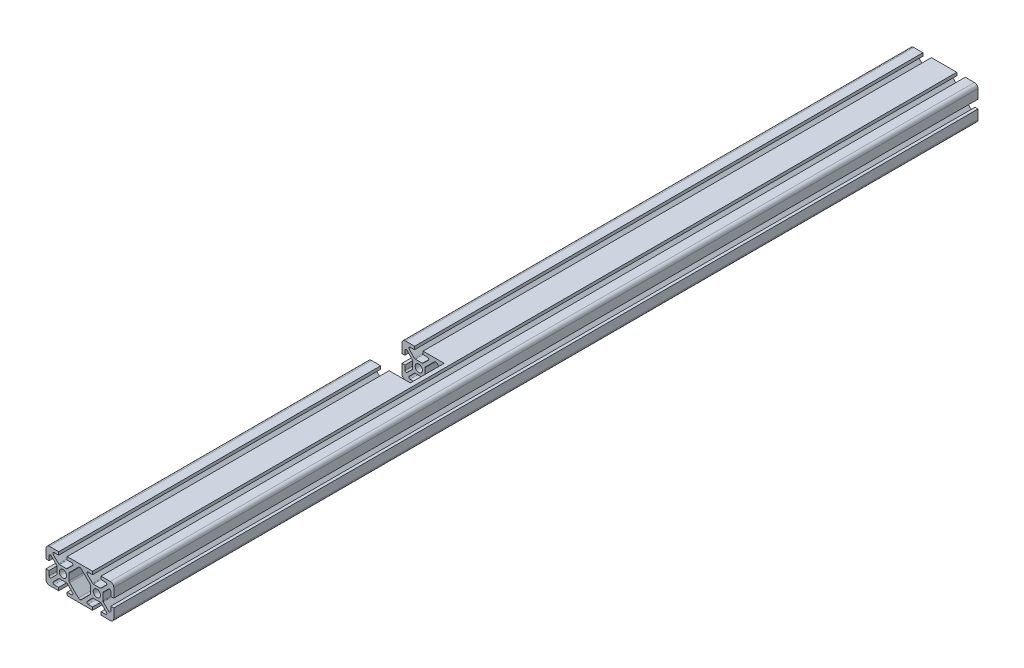
from build123d import *

# Parameters (mm, degrees)
BOSS_EXTRUDE1_DEPTH = 1524
BOSS_EXTRUDE2_DEPTH = 1524
FILLET1_R           = 0.75
FILLET2_R           = 1.25
SKETCH5_W           = 2538
SKETCH5_H           = 20
CUT_EXTRUDE1_DEPTH  = 1525.55764076
SKETCH6_W           = 25
SKETCH6_H           = 20
CUT_EXTRUDE2_DEPTH  = 40


with BuildPart() as part:
    # Sketch3 → Boss-Extrude1 (new, symmetric)
    with BuildSketch(Plane.XY):
        with BuildLine():
            Line((12.5, -10), (17.9, -10))
            ThreePointArc((17.9, -10), (19.38492424, -9.38492424), (20, -7.9))
            Line((20, -7.9), (20, -2.5))
            Line((20, -2.5), (18.213351365, -2.5))
            Line((18.213351365, -2.5), (18.213351365, -6.95))
            Line((18.213351365, -6.95), (13.6, -2.336648635))
            Line((13.6, -2.336648635), (13.6, 0))
            Line((13.6, 0), (12.15, 0))
            ThreePointArc((12.15, 0), (11.52027958, -1.52027958), (10, -2.15))
            Line((10, -2.15), (10, -3.6))
            Line((10, -3.6), (12.336648635, -3.6))
            Line((12.336648635, -3.6), (16.95, -8.213351365))
            Line((16.95, -8.213351365), (12.5, -8.213351365))
            Line((12.5, -8.213351365), (12.5, -10))
        make_face()
    extrude(amount=BOSS_EXTRUDE1_DEPTH, both=True)

    # Sketch4 → Boss-Extrude2 (add, symmetric)
    with BuildSketch(Plane.XY):
        with BuildLine():
            Line((10, -3.6), (7.663351365, -3.6))
            Line((7.663351365, -3.6), (3.05, -8.213351365))
            Line((3.05, -8.213351365), (7.5, -8.213351365))
            Line((7.5, -8.213351365), (7.5, -10))
            Line((7.5, -10), (0, -10))
            Line((0, -10), (0, -8.736648635))
            Line((0, -8.736648635), (6.4, -2.336648635))
            Line((6.4, -2.336648635), (6.4, 0))
            Line((6.4, 0), (7.85, 0))
            ThreePointArc((7.85, 0), (8.47972042, -1.52027958), (10, -2.15))
            Line((10, -2.15), (10, -3.6))
        make_face()
    extrude(amount=BOSS_EXTRUDE2_DEPTH, both=True)

    # Mirror1: part across plane


with BuildPart() as part_1:
    add(part.part)
    add(part.part.mirror(Plane(origin=(0, 0, 0), x_dir=(0, 0, 1), z_dir=(1, 0, 0))))

    # Mirror2: part across plane


with BuildPart() as part_2:
    add(part_1.part)
    add(part_1.part.mirror(Plane.ZX))

    # Fillet1
    fillet1_edges = [part_2.edges().sort_by_distance(p)[0] for p in [
        (-7.663351365, -3.6, 0),
        (-12.336648635, -3.6, 0),
        (12.336648635, -3.6, 0),
        (7.663351365, -3.6, 0),
        (-3.05, -8.213351365, 0),
        (-18.213351365, -6.95, 0),
        (-16.95, -8.213351365, 0),
        (-13.6, -2.336648635, 0),
        (-18.213351365, 6.95, 0),
        (-16.95, 8.213351365, 0),
        (-12.336648635, 3.6, 0),
        (-7.663351365, 3.6, 0),
        (-13.6, 2.336648635, 0),
        (-3.05, 8.213351365, 0),
        (3.05, 8.213351365, 0),
        (13.6, -2.336648635, 0),
        (13.6, 2.336648635, 0),
        (7.663351365, 3.6, 0),
        (12.336648635, 3.6, 0),
        (18.213351365, 6.95, 0),
        (16.95, 8.213351365, 0),
        (18.213351365, -6.95, 0),
        (16.95, -8.213351365, 0),
        (3.05, -8.213351365, 0),
    ]]
    fillet(fillet1_edges, radius=FILLET1_R)

    # Fillet2
    fillet2_edges = [part_2.edges().sort_by_distance(p)[0] for p in [
        (0, -8.736648635, 0),
        (-6.4, -2.336648635, 0),
        (-6.4, 2.336648635, 0),
        (6.4, -2.336648635, 0),
        (6.4, 2.336648635, 0),
        (0, 8.736648635, 0),
    ]]
    fillet(fillet2_edges, radius=FILLET2_R)

    # Sketch5 → Cut-Extrude1 (cut, through all)
    with BuildSketch(Plane.ZY.offset(20)):
        with Locations((255, 0)):
            Rectangle(SKETCH5_W, SKETCH5_H)
    extrude(amount=-CUT_EXTRUDE1_DEPTH, mode=Mode.SUBTRACT)

    # Sketch6 → Cut-Extrude2 (cut)
    with BuildSketch(Plane(origin=(0, 10, 0), x_dir=(1, 0, 0), z_dir=(0, 1, 0))):
        with Locations((-7.5, 1214)):
            Rectangle(SKETCH6_W, SKETCH6_H)
    extrude(amount=-CUT_EXTRUDE2_DEPTH, mode=Mode.SUBTRACT)


solid = part_2.part
